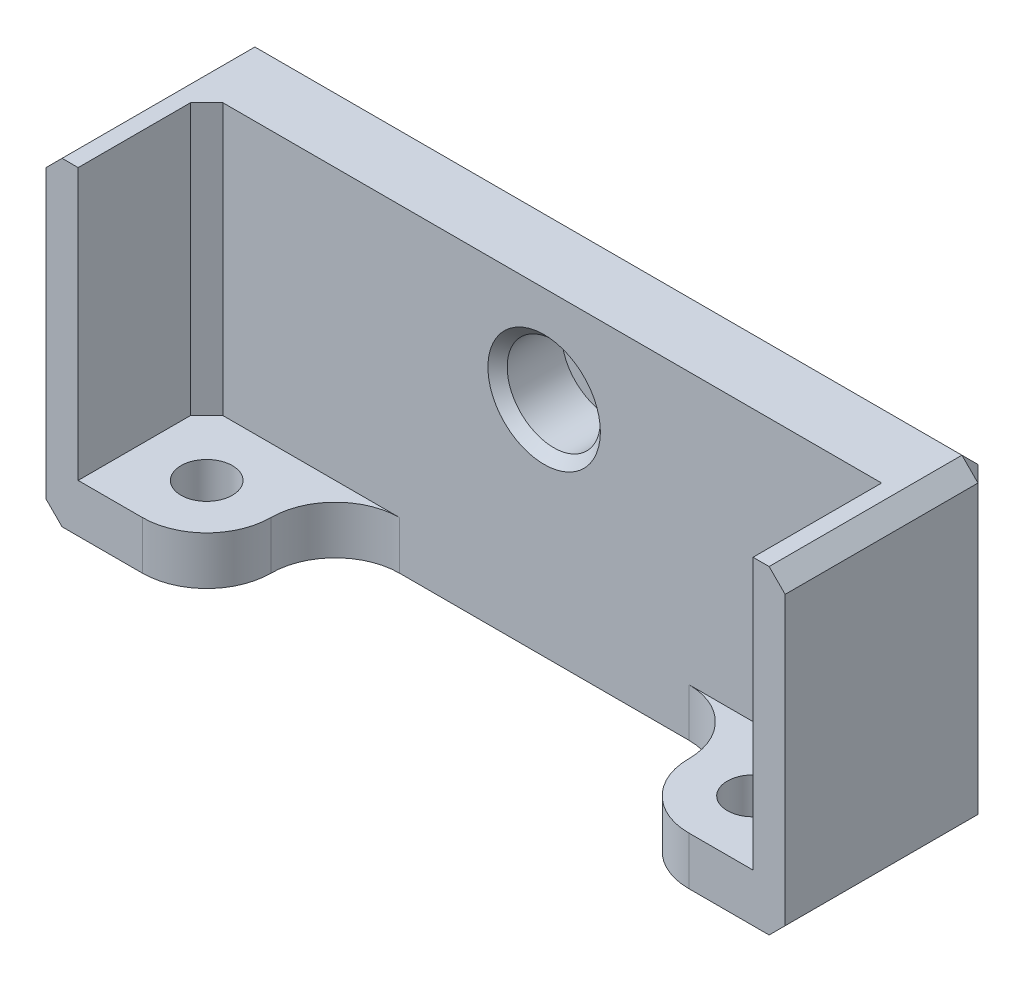
from build123d import *

# Parameters (mm, degrees)
SKETCH_1_R       = 2.9
EXTRUDE_1_DEPTH  = 4
CHAMFER_1_SIZE   = 0.6
SKETCH_3_W       = 12
SKETCH_3_H       = 19.86
EXTRUDE_2_DEPTH  = 2
SKETCH_4_W       = 10
SKETCH_4_H       = 12
SKETCH_4_R       = 1.6
EXTRUDE_3_DEPTH  = 3
FILLET_START     = -15
FILLET_2_DEPTH   = 4.14
FILLET_START_2   = -13.86
FILLET_2_2_DEPTH = 3
SKETCH_5_W       = 46
SKETCH_5_H       = 19.86
SKETCH_5_R       = 1.5
EXTRUDE_4_DEPTH  = 1
CHAMFER_4_SIZE   = 1


with BuildPart() as part:
    # 草图1 → 凸台-拉伸1 (new body)
    with BuildSketch(Plane.XY):
        Polygon((7.937253933, 6), (-21, 6), (-21, -13.86), (7.937253933, -13.86), (21, -13.86), (21, 6), align=None)
        Circle(SKETCH_1_R, mode=Mode.SUBTRACT)
    extrude(amount=EXTRUDE_1_DEPTH)

    # 倒角1
    chamfer_1_edges = [part.edges().sort_by_distance(p)[0] for p in [
        (-2.9, 0, 4),
    ]]
    chamfer(chamfer_1_edges, length=CHAMFER_1_SIZE)

    # 草图3 → 凸台-拉伸2 (add)
    with BuildSketch(Plane.ZY.offset(21)):
        with Locations((6, -3.93)):
            Rectangle(SKETCH_3_W, SKETCH_3_H)
    extrude_2 = extrude(amount=EXTRUDE_2_DEPTH)

    # 镜向1: 凸台-拉伸2 across plane
    add(extrude_2.mirror(Plane(origin=(0, 0, 0), x_dir=(0, 0, 1), z_dir=(1, 0, 0))))

    # 草图4 → 凸台-拉伸3 (add)
    # profile 1 of 2: a face of its own
    with BuildSketch(Plane.XZ.offset(13.86)):
        with Locations((-18, 6)):
            Rectangle(SKETCH_4_W, SKETCH_4_H)
        with Locations((-17, 8)):
            Circle(SKETCH_4_R, mode=Mode.SUBTRACT)
    # profile 2 of 2: a face of its own
    with BuildSketch(Plane.XZ.offset(13.86)):
        with Locations((18, 6)):
            Rectangle(SKETCH_4_W, SKETCH_4_H)
        with Locations(Location((17, 8, 0), (0, 0, 180))):
            Circle(SKETCH_4_R, mode=Mode.SUBTRACT)
    extrude(amount=-EXTRUDE_3_DEPTH)

    # 圆角2: read off the stored shape, not the designer's step
    # 圆角2 outline → 圆角2 (cut)
    with BuildSketch(Plane(origin=(0, 0, 0), x_dir=(1, 0, 0), z_dir=(0, 1, 0)).offset(FILLET_START)):
        with BuildLine():
            Line((13, -12), (17, -12))
            ThreePointArc((17, -12), (14.171572875, -10.828427125), (13, -8))
            Line((13, -8), (13, -12))
        make_face()
        with BuildLine():
            Line((-13, -12), (-13, -8))
            ThreePointArc((-13, -8), (-14.171572875, -10.828427125), (-17, -12))
            Line((-17, -12), (-13, -12))
        make_face()
    extrude(amount=FILLET_2_DEPTH, mode=Mode.SUBTRACT)

    # Fillet 2 2 outline → Fillet 2 2 (add)
    with BuildSketch(Plane(origin=(0, 0, 0), x_dir=(1, 0, 0), z_dir=(0, 1, 0)).offset(FILLET_START_2)):
        with BuildLine():
            ThreePointArc((-13, -8), (-11.828427125, -5.171572875), (-9, -4))
            Line((-9, -4), (-13, -4))
            Line((-13, -4), (-13, -8))
        make_face()
        with BuildLine():
            ThreePointArc((9, -4), (11.828427125, -5.171572875), (13, -8))
            Line((13, -8), (13, -4))
            Line((13, -4), (9, -4))
        make_face()
    extrude(amount=FILLET_2_2_DEPTH)

    # 草图5 → 凸台-拉伸4 (add)
    with BuildSketch(Plane(origin=(0, 0, 0), x_dir=(-1, 0, 0), z_dir=(0, 0, -1))):
        with Locations((0, -3.93)):
            Rectangle(SKETCH_5_W, SKETCH_5_H)
        Circle(SKETCH_5_R, mode=Mode.SUBTRACT)
    extrude(amount=EXTRUDE_4_DEPTH)

    # 倒角4
    chamfer_4_edges = [part.edges().sort_by_distance(p)[0] for p in [
        (0, 6, -1),
        (23, -3.93, -1),
        (0, -13.86, -1),
        (-23, 6, 5.5),
        (-23, -13.86, 5.5),
        (23, -13.86, 5.5),
        (23, 6, 5.5),
        (-21, -2.43, 4),
    ]]
    chamfer(chamfer_4_edges, length=CHAMFER_4_SIZE)


solid = part.part
